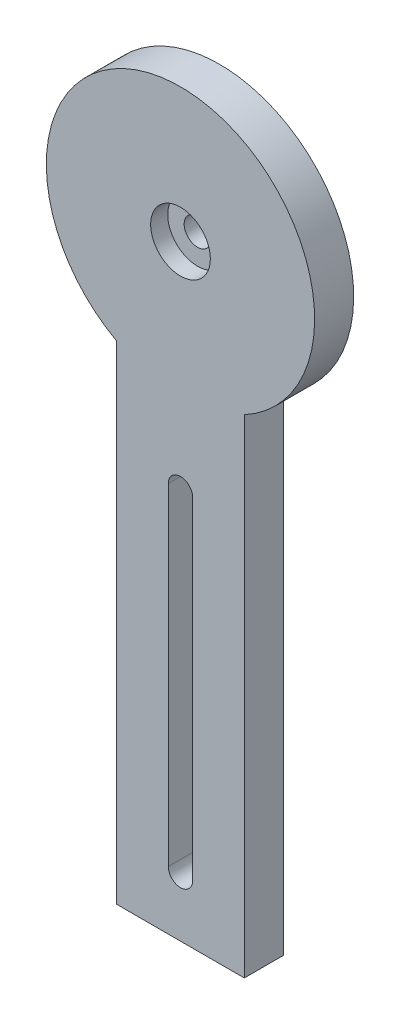
from build123d import *

# Parameters (mm, degrees)
ESTRUSIONE_ESTRUSIONE1_DEPTH                         = 4
TAGLIO_ESTRUSIONE1_DEPTH                             = 158.227985838
FORO_LAMATO_PER_BULLONE_M5_A_TESTA_ESAGO_D           = 5.5
FORO_LAMATO_PER_BULLONE_M5_A_TESTA_ESAGO_CBORE_D     = 12.238
FORO_LAMATO_PER_BULLONE_M5_A_TESTA_ESAGO_CBORE_DEPTH = 3.5


with BuildPart() as part:
    # Schizzo1 → Estrusione-Estrusione1 (new, symmetric)
    with BuildSketch(Plane.XY):
        with BuildLine():
            Line((0, 0), (0, 100))
            ThreePointArc((0, 100), (13.08, 151.690155022), (26.16, 100))
            Line((26.16, 100), (26.16, 0))
            Line((26.16, 0), (0, 0))
        make_face()
    extrude(amount=ESTRUSIONE_ESTRUSIONE1_DEPTH, both=True)

    # Schizzo2 → Taglio-Estrusione1 (cut, through all)
    with BuildSketch(Plane.XY.offset(4)):
        with BuildLine():
            Line((10.58, 12), (10.58, 80))
            ThreePointArc((10.58, 80), (13.08, 82.5), (15.58, 80))
            Line((15.58, 80), (15.58, 12))
            ThreePointArc((15.58, 12), (13.08, 9.5), (10.58, 12))
        make_face()
    extrude(amount=-TAGLIO_ESTRUSIONE1_DEPTH, mode=Mode.SUBTRACT)

    # Foro lamato per Bullone M5 a testa esagonale-1 (through all)
    with Locations(Plane.XY.offset(4)):
        with Locations((13.08, 124.190155022)):
            CounterBoreHole(FORO_LAMATO_PER_BULLONE_M5_A_TESTA_ESAGO_D / 2, FORO_LAMATO_PER_BULLONE_M5_A_TESTA_ESAGO_CBORE_D / 2, FORO_LAMATO_PER_BULLONE_M5_A_TESTA_ESAGO_CBORE_DEPTH)


solid = part.part
